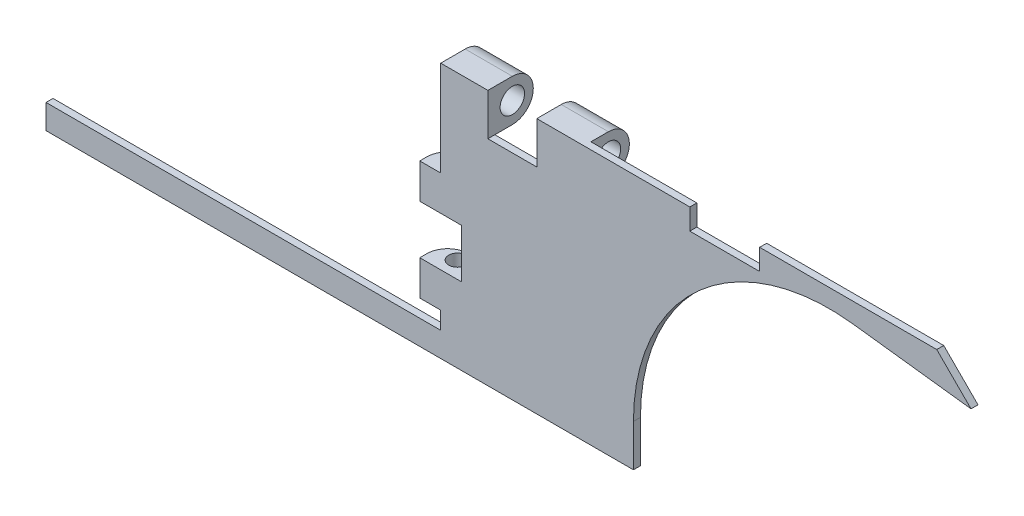
from build123d import *

# Parameters (mm, degrees)
BOSS_EXTRUDE1_DEPTH = 0.5
BOSS_EXTRUDE6_DEPTH = 5
BOSS_EXTRUDE5_DEPTH = 6.75
LPATTERN2_COUNT     = 2
LPATTERN2_PITCH     = 13.75
CUT_EXTRUDE4_REACH  = 84.156
SKETCH10_R          = 1.75
LPATTERN3_COUNT     = 2
LPATTERN3_PITCH     = 12
CUT_EXTRUDE5_REACH  = 84.156
SKETCH12_R          = 1.25
SKETCH13_W          = 7
SKETCH13_H          = 6
CUT_EXTRUDE6_DEPTH  = 1
CHAMFER1_SIZE       = 5
CUT_EXTRUDE8_REACH  = 84.105
SKETCH15_W          = 10
SKETCH15_H          = 3
CUT_EXTRUDE9_REACH  = 84.032
SKETCH16_W          = 3
SKETCH16_H          = 7


with BuildPart() as part:
    # Sketch1 → Boss-Extrude1 (new, symmetric)
    with BuildSketch(Plane.XY):
        with BuildLine():
            Line((-56.5, -6), (27.587658385, -6))
            Line((27.587658385, -6), (27.587658385, 0))
            ThreePointArc((27.587658385, 0), (37.034297035, 20.970760182), (59, 27.791292246))
            Line((59, 27.791292246), (76, 25.703954711))
            Line((76, 25.703954711), (76, 30.62))
            Line((76, 30.62), (0, 30.62))
            Line((0, 30.62), (0, -2.5))
            Line((0, -2.5), (-56.5, -2.5))
            Line((-56.5, -2.5), (-56.5, -6))
        make_face()
    extrude(amount=BOSS_EXTRUDE1_DEPTH, both=True)

    # Sketch5 → Boss-Extrude6 (add)
    with BuildSketch(Plane(origin=(0, 0, 0), x_dir=(1, 0, 0), z_dir=(0, 1, 0))):
        with BuildLine():
            Line((0, 0.5), (3, 0.5))
            ThreePointArc((3, 0.5), (0, 3.5), (-3, 0.5))
            Line((-3, 0.5), (-3, -0.5))
            Line((-3, -0.5), (0, -0.5))
            Line((0, -0.5), (0, 0.5))
        make_face()
    boss_extrude6 = extrude(amount=BOSS_EXTRUDE6_DEPTH)

    # Sketch9 → Boss-Extrude5 (add)
    with BuildSketch(Plane.ZY):
        with BuildLine():
            Line((-0.5, 30.62), (-3, 30.62))
            ThreePointArc((-3, 30.62), (-6, 27.62), (-3, 24.62))
            Line((-3, 24.62), (-0.5, 24.62))
            Line((-0.5, 24.62), (-0.5, 30.62))
        make_face()
    boss_extrude5 = extrude(amount=-BOSS_EXTRUDE5_DEPTH)

    # LPattern2: Boss-Extrude5 ×2
    with Locations(*[(i * LPATTERN2_PITCH, 0, 0) for i in range(1, LPATTERN2_COUNT)]):
        add(boss_extrude5)

    # Cut-Extrude4: up to this face of the body (flat: up to its plane)
    cut_extrude4_end = Plane(part.part.faces().sort_by_distance((20.5, 27.62, -2.97425968))[0])
    # Sketch10 → Cut-Extrude4 (cut, up to the picked face)
    with BuildSketch(Plane.ZY, mode=Mode.PRIVATE) as cut_extrude4_sk1:
        with Locations((-3, 27.62)):
            Circle(SKETCH10_R)
    cut_extrude4_tool1 = split(extrude(cut_extrude4_sk1.sketch, amount=-CUT_EXTRUDE4_REACH, mode=Mode.PRIVATE), bisect_by=cut_extrude4_end, keep=Keep.BOTH, mode=Mode.PRIVATE)
    add(cut_extrude4_tool1.solids().sort_by(Axis((0, 27.62, -3), (1, 0, 0)))[0], mode=Mode.SUBTRACT)

    # LPattern3: Boss-Extrude6 ×2
    with Locations(*[(0, i * LPATTERN3_PITCH, 0) for i in range(1, LPATTERN3_COUNT)]):
        add(boss_extrude6)

    # Cut-Extrude5: up to this face of the body (flat: up to its plane)
    cut_extrude5_end = Plane(part.part.faces().sort_by_distance((-0.26258716, 17, -1.462819587))[0])
    # Sketch12 → Cut-Extrude5 (cut, up to the picked face)
    with BuildSketch(Plane.XZ, mode=Mode.PRIVATE) as cut_extrude5_sk1:
        with Locations(Location((0, -1.9, 0), (0, 0, 270))):
            Circle(SKETCH12_R)
    cut_extrude5_tool1 = split(extrude(cut_extrude5_sk1.sketch, amount=-CUT_EXTRUDE5_REACH, mode=Mode.PRIVATE), bisect_by=cut_extrude5_end, keep=Keep.BOTH, mode=Mode.PRIVATE)
    add(cut_extrude5_tool1.solids().sort_by(Axis((0, 0, -1.9), (0, 1, 0)))[0], mode=Mode.SUBTRACT)

    # Sketch13 → Cut-Extrude6 (cut)
    with BuildSketch(Plane(origin=(0, 0, -0.5), x_dir=(-1, 0, 0), z_dir=(0, 0, -1))):
        with Locations((-10.25, 27.62)):
            Rectangle(SKETCH13_W, SKETCH13_H)
    extrude(amount=-CUT_EXTRUDE6_DEPTH, mode=Mode.SUBTRACT)

    # Chamfer1
    # the kernel refuses this chamfer: 5 mm, written as the material it takes off along each edge
    with BuildSketch(Plane(origin=(76, 30.62, 13.35841494), x_dir=(-0.9996219169112968, 0.027495876610586282, 0), z_dir=(0, 0, -1))) as chamfer1_piece_1:
        Polygon((CHAMFER1_SIZE * 0.999621916911, -CHAMFER1_SIZE * 0.0274958766106), (-CHAMFER1_SIZE * 0.0274958766106, -CHAMFER1_SIZE * 0.999621916911), (0, 0), align=None)
    extrude(amount=26.71682988, mode=Mode.SUBTRACT)

    # Sketch15 → Cut-Extrude8 (cut, up to next)
    with BuildSketch(Plane.XY.offset(0.5), mode=Mode.PRIVATE) as cut_extrude8_sk1:
        with Locations((40.65429408, 29.12)):
            Rectangle(SKETCH15_W, SKETCH15_H)
    cut_extrude8_tool1 = extrude(cut_extrude8_sk1.sketch, amount=-CUT_EXTRUDE8_REACH, mode=Mode.PRIVATE) & part.part
    add(cut_extrude8_tool1.solids().sort_by_distance((40.654294, 29.12, 0.5))[0], mode=Mode.SUBTRACT)

    # Sketch16 → Cut-Extrude9 (cut, up to next)
    with BuildSketch(Plane(origin=(0, 0, -0.5), x_dir=(-1, 0, 0), z_dir=(0, 0, -1)), mode=Mode.PRIVATE) as cut_extrude9_sk1:
        with Locations((-1.5, 8.5)):
            Rectangle(SKETCH16_W, SKETCH16_H)
    cut_extrude9_tool1 = extrude(cut_extrude9_sk1.sketch, amount=-CUT_EXTRUDE9_REACH, mode=Mode.PRIVATE) & part.part
    add(cut_extrude9_tool1.solids().sort_by_distance((1.5, 8.5, -0.5))[0], mode=Mode.SUBTRACT)


solid = part.part
